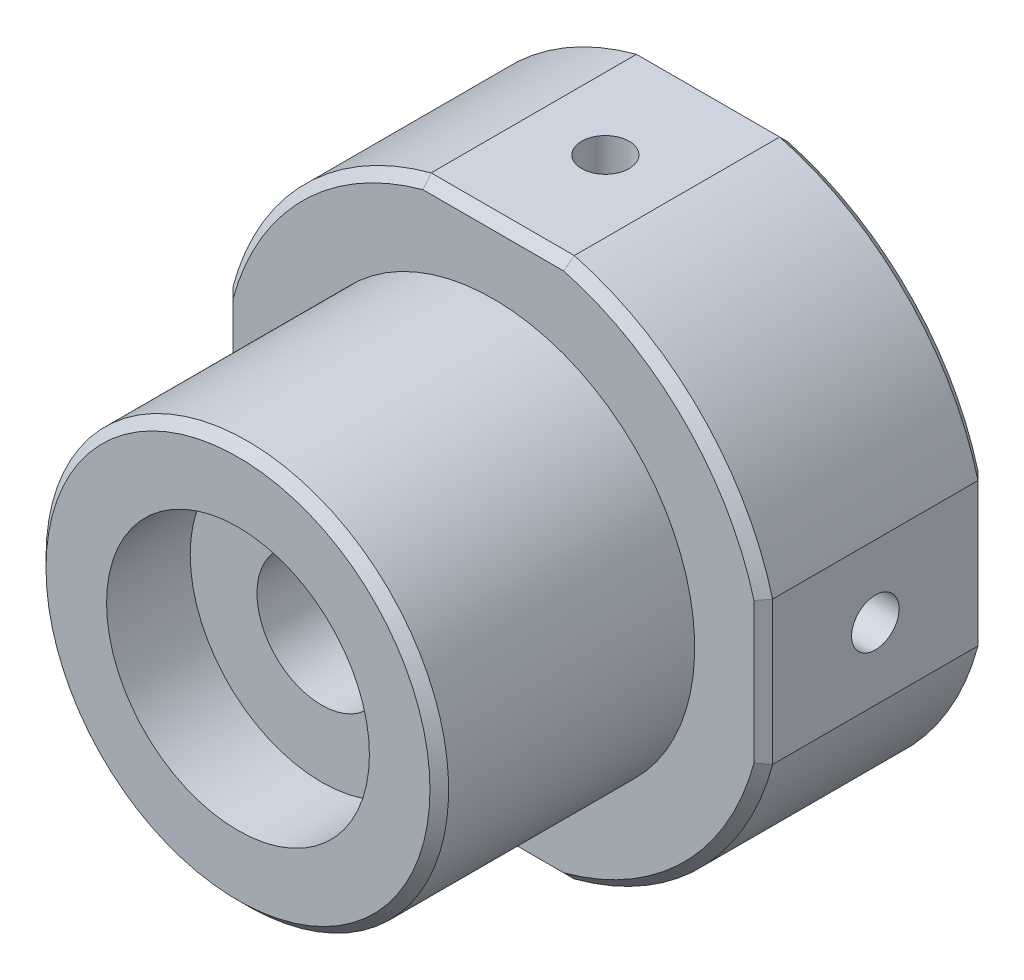
from build123d import *

# Parameters (mm, degrees)
BOSS_EXTRUDE1_DEPTH = 9.525
SKETCH2_R           = 11.176
SKETCH2_R_2         = 5.500370000000001
CUT_EXTRUDE1_DEPTH  = 7.112
SKETCH3_R           = 17.119600000000002
BOSS_EXTRUDE2_DEPTH = 21.717
SKETCH2_3_R         = 5.500370000000001
CUT_EXTRUDE2_DEPTH  = 53.11367665138399
CUT_EXTRUDE3_START  = -7.112
SKETCH4_R           = 11.176
CUT_EXTRUDE3_DEPTH  = 7.112
CIRPATTERN1_COUNT   = 4
CHAMFER2_SIZE       = 0.79375
CUT_EXTRUDE4_DEPTH  = 12.7
FILLET2_R           = 3.429


# Some blends are built 0.0001 mm under size
with BuildPart() as part:
    # Sketch1 → Boss-Extrude1 (new, symmetric)
    with BuildSketch(Plane.XY):
        with BuildLine():
            Line((6.0886368291679185, 22.95525), (-6.0886368291679185, 22.95525))
            ThreePointArc((-6.088636829167921, 22.955250000000003), (-16.793078946399227, 16.793078946399408), (-22.95524999999994, 6.088636829168165))
            Line((-22.95524999999994, 6.08863682916816), (-22.955250000000003, 0))
            Line((-22.955250000000003, 0), (22.95525, 0))
            Line((22.95525, 0), (22.95525000000002, 6.088636829167839))
            ThreePointArc((22.955250000000024, 6.088636829167841), (16.793078946399348, 16.79307894639929), (6.0886368291679185, 22.955250000000003))
        make_face()
        with BuildLine():
            Line((22.95525, 0), (-22.955250000000003, 0))
            Line((-22.955250000000003, 0), (-22.955250000000063, -6.088636829167679))
            ThreePointArc((-22.955250000000067, -6.0886368291676805), (-16.79307894639947, -16.793078946399167), (-6.088636829168085, -22.95524999999996))
            Line((-6.088636829168078, -22.955249999999957), (6.08863682916776, -22.955250000000042))
            ThreePointArc((6.08863682916775, -22.955250000000046), (16.793078946399223, -16.79307894639941), (22.95524999999998, -6.088636829168005))
            Line((22.955249999999978, -6.088636829167999), (22.95525, 0))
        make_face()
    extrude(amount=BOSS_EXTRUDE1_DEPTH, both=True)

    # Sketch2 → Cut-Extrude1 (cut)
    # profile 1 of 2: a face of its own
    with BuildSketch(Plane(origin=(0, 0, -9.525), x_dir=(-1, 0, 0), z_dir=(0, 0, -1))):
        Circle(SKETCH2_R)
        Circle(SKETCH2_R_2, mode=Mode.SUBTRACT)
    # profile 2 of 2: a face of its own
    with BuildSketch(Plane(origin=(0, 0, -9.525), x_dir=(-1, 0, 0), z_dir=(0, 0, -1))):
        Circle(SKETCH2_R_2)
    extrude(amount=-CUT_EXTRUDE1_DEPTH, mode=Mode.SUBTRACT)

    # Sketch3 → Boss-Extrude2 (add)
    with BuildSketch(Plane.XY.offset(9.525)):
        with Locations(Location((0, 0, 0), (0, 0, 180))):
            Circle(SKETCH3_R)
    extrude(amount=BOSS_EXTRUDE2_DEPTH)

    # Sketch2<3> → Cut-Extrude2 (cut, through all)
    with BuildSketch(Plane(origin=(0, 0, -9.525), x_dir=(-1, 0, 0), z_dir=(0, 0, -1))):
        Circle(SKETCH2_3_R)
    extrude(amount=-CUT_EXTRUDE2_DEPTH, mode=Mode.SUBTRACT)

    # Sketch4 → Cut-Extrude3 (cut)
    with BuildSketch(Plane.XY.offset(31.241999999999997).offset(CUT_EXTRUDE3_START)):
        with Locations(Location((0, 0, 0), (0, 0, 180))):
            Circle(SKETCH4_R)
    extrude(amount=CUT_EXTRUDE3_DEPTH, mode=Mode.SUBTRACT)

    # Sketch7 → #10-32 Tapped Hole1 (revolve, cut)
    with BuildSketch(Plane(origin=(-22.95525, 2.3545e-13, 0), x_dir=(0, 0, 1), z_dir=(1.026e-14, 1, 0))):
        Polygon((0, 0), (-3.04e-15, 12.065), (2.019299999999997, 10.851682151997645), (2.0192999999999897, -1.31e-15), align=None)
    f_10_32_tapped_hole1 = revolve(axis=Axis((-29.30524999999999, 3.0058e-13, 0), (1, -1.026e-14, 0)), mode=Mode.SUBTRACT)

    # CirPattern1: #10-32 Tapped Hole1 ×4 about axis
    cirpattern1_axis = Axis((0, 0, 31.241999999999997), (0, 0, 1))
    for i in range(1, CIRPATTERN1_COUNT):
        add(f_10_32_tapped_hole1.rotate(cirpattern1_axis, i * 360 / CIRPATTERN1_COUNT), mode=Mode.SUBTRACT)

    # Chamfer2
    chamfer2_edges = [part.edges().sort_by_distance(p)[0] for p in [
        (16.793078946399344, 16.79307894639929, -9.525),
        (22.95525, -8.171e-14, -9.525),
        (-16.793078946399465, -16.79307894639917, 9.525),
        (16.793078946399223, -16.79307894639941, -9.525),
        (-1.5898e-13, -22.95525, -9.525),
        (-16.793078946399465, -16.79307894639917, -9.525),
        (-22.955250000000003, 2.407e-13, -9.525),
        (-1.5898e-13, -22.95525, 9.525),
        (16.793078946399223, -16.79307894639941, 9.525),
        (22.95525, -8.082e-14, 9.525),
        (16.793078946399344, 16.79307894639929, 9.525),
        (17.119600000000002, -4.19e-15, 31.241999999999997),
        (0, 22.95525, 9.525),
        (-16.79307894639923, 16.79307894639941, 9.525),
        (-22.955250000000003, 2.4158e-13, 9.525),
        (-16.79307894639923, 16.79307894639941, -9.525),
        (0, 22.95525, -9.525),
    ]]
    chamfer(chamfer2_edges, length=CHAMFER2_SIZE - 0.0001)  # a hair under: the kernel refuses the full size

    # Sketch8 → Cut-Extrude4 (cut)
    with BuildSketch(Plane(origin=(0, 0, -9.525), x_dir=(-1, 0, 0), z_dir=(0, 0, -1))):
        with BuildLine():
            ThreePointArc((-3.7411998688127595, -13.854769017980608), (-10.14768941680823, -10.147689416808056), (-13.854769017980674, -3.741199868812521))
            Line((-13.854769017980672, -3.7411998688125214), (-19.096285615491066, -5.156565305907526))
            ThreePointArc((-19.096285615491066, -5.1565653059075265), (-13.986748908565335, -13.98674890856509), (-5.156565305907854, -19.09628561549097))
            Line((-5.156565305907857, -19.096285615490967), (-3.741199868812765, -13.854769017980608))
        make_face()
        with BuildLine():
            ThreePointArc((13.854769017980626, -3.7411998688126986), (10.147689416808095, -10.14768941680819), (3.741199868812558, -13.854769017980665))
            Line((3.7411998688125703, -13.854769017980663), (5.156565305907591, -19.09628561549104))
            ThreePointArc((5.156565305907593, -19.096285615491045), (13.986748908565135, -13.986748908565279), (19.09628561549099, -5.156565305907787))
            Line((19.096285615490988, -5.1565653059077885), (13.854769017980622, -3.741199868812714))
        make_face()
        with BuildLine():
            Line((5.156565305907724, 19.096285615491006), (3.741199868812667, 13.854769017980631))
            ThreePointArc((3.7411998688126653, 13.854769017980633), (10.147689416808161, 10.147689416808124), (13.854769017980649, 3.741199868812616))
            Line((13.854769017980647, 3.741199868812618), (19.096285615491023, 5.156565305907658))
            ThreePointArc((19.096285615491027, 5.15656530590766), (13.98674890856523, 13.986748908565183), (5.156565305907728, 19.09628561549101))
        make_face()
        with BuildLine():
            ThreePointArc((-5.1565653059077246, 19.096285615491006), (-13.986748908565236, 13.986748908565183), (-19.096285615491023, 5.1565653059076535))
            Line((-19.096285615491023, 5.156565305907655), (-13.854769017980647, 3.7411998688126173))
            ThreePointArc((-13.854769017980647, 3.741199868812617), (-10.14768941680816, 10.147689416808126), (-3.741199868812667, 13.854769017980633))
            Line((-3.741199868812666, 13.854769017980635), (-5.1565653059077246, 19.096285615491006))
        make_face()
    extrude(amount=-CUT_EXTRUDE4_DEPTH, mode=Mode.SUBTRACT)

    # Fillet2
    # the kernel refuses this fillet: 3.429 mm, written as the material it adds along each edge
    with BuildSketch(Plane(origin=(-5.156565305907593, -19.096285615491045, -9.525), x_dir=(-0.9325520544220317, 0.3610355464400257, 0), z_dir=(0, 0, 1))) as fillet2_piece_1:
        with BuildLine():
            CenterArc((3.8097835082284277, -3.409884824393312), FILLET2_R, 83.94735795443728, 102.10528409112533)
            Line((0.39989868383511423, -3.771446000921142), (0, 0))
            ThreePointArc((0, 0), (2.085672342378129, 0.11026624447191213), (4.171344684756262, 8e-17))
        make_face()
    extrude(amount=12.7)
    with BuildSketch(Plane(origin=(-19.096285615491027, 5.15656530590766, -9.525), x_dir=(0.965421853388659, -0.26069262551826505, 0), z_dir=(0, 0, 1))) as fillet2_piece_2:
        with BuildLine():
            CenterArc((3.792588020758013, 3.4290000000000003), FILLET2_R, 167.8947159088747, 102.10528409112533)
            ThreePointArc((0.4398356056936713, 4.148091262135922), (0.11026624447190661, 2.0856723423781296), (0, 0))
            Line((0, 0), (3.7925880207580134, -5e-17))
        make_face()
    extrude(amount=12.7)
    with BuildSketch(Plane(origin=(-5.156565305907726, 19.096285615491006, -9.525), x_dir=(0.26069262551826866, -0.9654218533886582, 0), z_dir=(0, 0, 1))) as fillet2_piece_3:
        with BuildLine():
            CenterArc((3.792588020758004, -3.4290000000000003), FILLET2_R, 89.99999999999996, 102.10528409112538)
            ThreePointArc((0.4398356056936635, -4.148091262135923), (0.11026624447190603, -2.0856723423781314), (0, 0))
            Line((0, 0), (3.7925880207580063, -7e-17))
        make_face()
    extrude(amount=12.7)
    with BuildSketch(Plane(origin=(-13.854769017980626, -3.741199868812707, -9.525), x_dir=(-0.9654218533886567, -0.26069262551827366, 0), z_dir=(0, 0, 1))) as fillet2_piece_4:
        with BuildLine():
            CenterArc((3.095213314069055, 3.4289999999999994), FILLET2_R, 191.11957095345258, 78.88042904654725)
            ThreePointArc((-0.2694135393585486, 2.7676928571428627), (-0.06751218545229558, 1.3903873027568008), (0, 0))
            Line((0, 0), (3.095213314069046, -1e-16))
        make_face()
    extrude(amount=12.7)
    with BuildSketch(Plane(origin=(-19.09628561549099, -5.156565305907787, -9.525), x_dir=(0.9654218533886576, 0.26069262551827094, 0), z_dir=(0, 0, 1))) as fillet2_piece_5:
        with BuildLine():
            CenterArc((3.7925880207580076, -3.4290000000000007), FILLET2_R, 90.00000000000001, 102.10528409112538)
            ThreePointArc((0.439835605693668, -4.148091262135926), (0.11026624447190793, -2.0856723423781336), (0, 0))
            Line((0, 0), (3.792588020758007, 3e-17))
        make_face()
    extrude(amount=12.7)
    with BuildSketch(Plane(origin=(-3.741199868812565, -13.854769017980665, -9.525), x_dir=(-0.2606926255182637, -0.9654218533886595, 0), z_dir=(0, 0, 1))) as fillet2_piece_6:
        with BuildLine():
            CenterArc((3.095213314069052, -3.429), FILLET2_R, 90.00000000000011, 78.88042904654733)
            ThreePointArc((-0.26941353935855195, -2.7676928571428654), (-0.06751218545229434, -1.3903873027568034), (0, 0))
            Line((0, 0), (3.095213314069045, 2e-17))
        make_face()
    extrude(amount=12.7)
    with BuildSketch(Plane(origin=(5.156565305907854, -19.09628561549097, -9.525), x_dir=(0.9325520544220268, 0.36103554644003844, 0), z_dir=(0, 0, 1))) as fillet2_piece_7:
        with BuildLine():
            CenterArc((3.8097835082284335, 3.409884824393312), FILLET2_R, 173.94735795443748, 102.10528409112516)
            Line((0.3998986838351195, 3.7714460009211352), (0, 0))
            ThreePointArc((0, 0), (2.0856723423781314, -0.11026624447191156), (4.171344684756263, -1.5e-16))
        make_face()
    extrude(amount=12.7)
    with BuildSketch(Plane(origin=(3.741199868812762, -13.854769017980608, -9.525), x_dir=(0.9356231316515913, 0.3530005035668774, 0), z_dir=(0, 0, 1))) as fillet2_piece_8:
        with BuildLine():
            CenterArc((3.112991040685577, -3.412868769847682), FILLET2_R, 95.55978547672635, 78.88042904654728)
            Line((-0.29987772916210453, -3.080652334675703), (0, 0))
            ThreePointArc((0, 0), (1.3903873027568012, -0.06751218545229684), (2.7807746055135993, 2e-17))
        make_face()
    extrude(amount=12.7)
    with BuildSketch(Plane(origin=(19.096285615491063, -5.156565305907526, -9.525), x_dir=(-0.36103554644002145, -0.9325520544220334, 0), z_dir=(0, 0, 1))) as fillet2_piece_9:
        with BuildLine():
            CenterArc((3.8097835082284273, -3.4098848243933118), FILLET2_R, 83.94735795443727, 102.10528409112533)
            Line((0.39989868383511423, -3.771446000921139), (0, 0))
            ThreePointArc((0, 0), (2.08567234237813, 0.11026624447191419), (4.171344684756262, 9e-17))
        make_face()
    extrude(amount=12.7)
    with BuildSketch(Plane(origin=(13.854769017980672, -3.741199868812522, -9.525), x_dir=(0.9654218533886609, -0.2606926255182579, 0), z_dir=(0, 0, 1))) as fillet2_piece_10:
        with BuildLine():
            CenterArc((3.095213314069046, -3.4289999999999994), FILLET2_R, 89.99999999999999, 78.88042904654729)
            ThreePointArc((-0.26941353935855583, -2.7676928571428556), (-0.06751218545229619, -1.3903873027567997), (0, 0))
            Line((0, 0), (3.0952133140690474, 2e-17))
        make_face()
    extrude(amount=12.7)
    with BuildSketch(Plane(origin=(13.854769017980647, 3.7411998688126173, -9.525), x_dir=(-0.3530005035668672, 0.9356231316515952, 0), z_dir=(0, 0, 1))) as fillet2_piece_11:
        with BuildLine():
            CenterArc((3.1129910406855728, -3.412868769847681), FILLET2_R, 95.55978547672636, 78.88042904654723)
            Line((-0.29987772916210814, -3.0806523346756998), (0, 0))
            ThreePointArc((0, 0), (1.3903873027567972, -0.06751218545229692), (2.780774605513595, -5e-17))
        make_face()
    extrude(amount=12.7)
    with BuildSketch(Plane(origin=(19.09628561549102, 5.1565653059076535, -9.525), x_dir=(-0.9654218533886593, -0.2606926255182644, 0), z_dir=(0, 0, 1))) as fillet2_piece_12:
        with BuildLine():
            CenterArc((3.7925880207580005, -3.429), FILLET2_R, 90.00000000000001, 102.10528409112527)
            ThreePointArc((0.4398356056936603, -4.148091262135919), (0.11026624447190564, -2.0856723423781256), (0, 0))
            Line((0, 0), (3.792588020758, -7e-17))
        make_face()
    extrude(amount=12.7)
    with BuildSketch(Plane(origin=(3.7411998688126658, 13.854769017980633, -9.525), x_dir=(0.9356231316515938, -0.35300050356687046, 0), z_dir=(0, 0, 1))) as fillet2_piece_13:
        with BuildLine():
            CenterArc((3.1129910406855763, 3.412868769847681), FILLET2_R, 185.55978547672632, 78.8804290465473)
            Line((-0.29987772916210376, 3.080652334675704), (0, 0))
            ThreePointArc((0, 0), (1.3903873027567977, 0.06751218545229833), (2.780774605513599, 1.1e-16))
        make_face()
    extrude(amount=12.7)
    with BuildSketch(Plane(origin=(5.1565653059077246, 19.096285615491006, -9.525), x_dir=(0.9325520544220295, -0.3610355464400313, 0), z_dir=(0, 0, 1))) as fillet2_piece_14:
        with BuildLine():
            CenterArc((3.8097835082284233, -3.4098848243933118), FILLET2_R, 83.9473579544373, 102.10528409112527)
            Line((0.39989868383510974, -3.7714460009211384), (0, 0))
            ThreePointArc((0, 0), (2.0856723423781274, 0.11026624447191274), (4.171344684756256, -2e-17))
        make_face()
    extrude(amount=12.7)
    with BuildSketch(Plane(origin=(-13.854769017980647, 3.7411998688126173, -9.525), x_dir=(-0.965421853388659, 0.26069262551826505, 0), z_dir=(0, 0, 1))) as fillet2_piece_15:
        with BuildLine():
            CenterArc((3.095213314069046, -3.429), FILLET2_R, 90, 78.8804290465473)
            ThreePointArc((-0.26941353935855566, -2.7676928571428574), (-0.06751218545229724, -1.390387302756799), (0, 0))
            Line((0, 0), (3.095213314069046, 7e-17))
        make_face()
    extrude(amount=12.7)
    with BuildSketch(Plane(origin=(-3.741199868812666, 13.854769017980633, -9.525), x_dir=(-0.9356231316515938, -0.35300050356687074, 0), z_dir=(0, 0, 1))) as fillet2_piece_16:
        with BuildLine():
            CenterArc((3.1129910406855745, -3.4128687698476816), FILLET2_R, 95.55978547672635, 78.8804290465473)
            Line((-0.2998777291621067, -3.0806523346757038), (0, 0))
            ThreePointArc((0, 0), (1.3903873027567981, -0.0675121854522969), (2.780774605513597, 1e-17))
        make_face()
    extrude(amount=12.7)


solid = part.part
